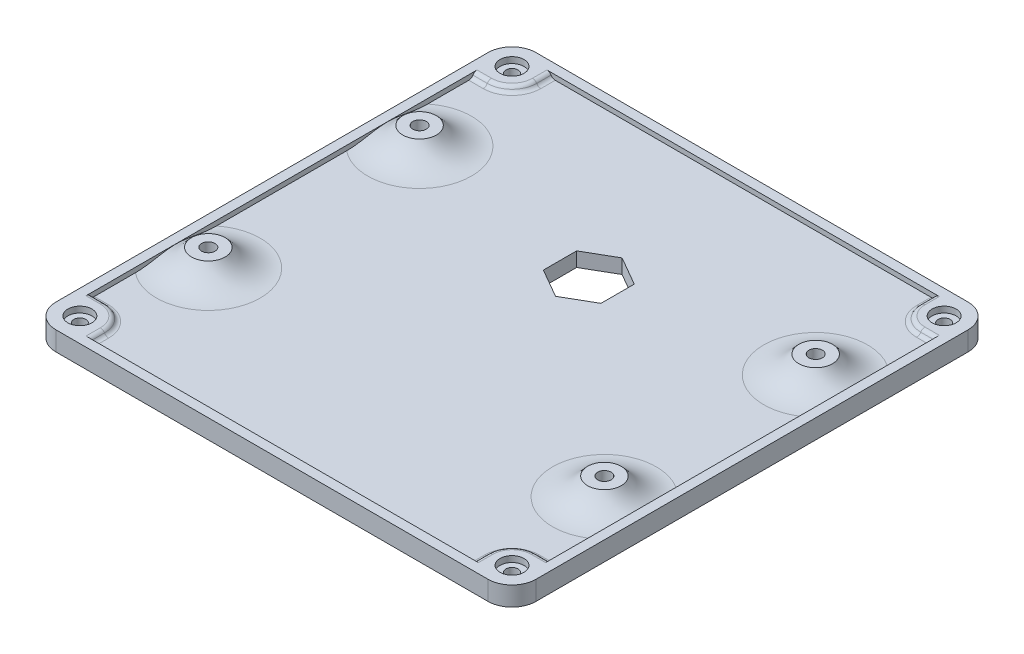
from build123d import *

# Parameters (mm, degrees)
SKETCH1_W            = 100
SKETCH1_H            = 100
BOSS_EXTRUDE1_DEPTH  = 4
SKETCH2_W            = 96
SKETCH2_H            = 96
CUT_EXTRUDE1_DEPTH   = 1
SKETCH7_W            = 8
SKETCH7_H            = 8
BOSS_EXTRUDE4_DEPTH  = 1
SKETCH9_W            = 8
SKETCH9_H            = 8
BOSS_EXTRUDE5_DEPTH  = 1
SKETCH10_W           = 8
SKETCH10_H           = 8
BOSS_EXTRUDE6_DEPTH  = 1
SKETCH11_W           = 8
SKETCH11_H           = 8
BOSS_EXTRUDE7_DEPTH  = 1
FILLET8_R            = 5
FILLET9_R            = 5
FILLET10_R           = 5
FILLET11_R           = 5
FILLET12_R           = 5
FILLET13_R           = 5
FILLET14_R           = 5
FILLET15_R           = 5
FILLET18_R           = 1
FILLET19_R           = 1
FILLET20_R           = 1
FILLET21_R           = 1
FILLET22_R           = 1
FILLET23_R           = 1
FILLET24_R           = 1
FILLET25_R           = 1
SKETCH15_R           = 2.5
CUT_EXTRUDE7_DEPTH   = 1.25
CUT_EXTRUDE8_START   = -1.25
SKETCH16_R           = 2.5
CUT_EXTRUDE8_DEPTH   = 1.25
SKETCH17_R           = 1.1
CUT_EXTRUDE9_DEPTH   = 1.5
SKETCH18_R           = 2.5
CUT_EXTRUDE10_DEPTH  = 1.25
CUT_EXTRUDE11_START  = -1.25
SKETCH19_R           = 2.5
CUT_EXTRUDE11_DEPTH  = 1.25
SKETCH20_R           = 1.05
CUT_EXTRUDE12_DEPTH  = 71.764132864
SKETCH21_R           = 2.5
CUT_EXTRUDE13_DEPTH  = 1.25
CUT_EXTRUDE14_START  = -1.25
SKETCH23_R           = 2.5
CUT_EXTRUDE14_DEPTH  = 1.25
SKETCH24_R           = 1.05
CUT_EXTRUDE15_DEPTH  = 71.764132864
SKETCH25_R           = 2.5
CUT_EXTRUDE16_DEPTH  = 1.25
CUT_EXTRUDE17_START  = -1.25
SKETCH26_R           = 2.5
CUT_EXTRUDE17_DEPTH  = 1.25
SKETCH27_R           = 1.05
CUT_EXTRUDE18_DEPTH  = 71.764132864
SKETCH35_R           = 1.25
CUT_EXTRUDE23_DEPTH  = 71.764132864
SKETCH36_R           = 1.25
CUT_EXTRUDE24_DEPTH  = 71.764132864
SKETCH37_R           = 1.25
CUT_EXTRUDE25_DEPTH  = 71.764132864
SKETCH38_R           = 1.25
CUT_EXTRUDE26_DEPTH  = 71.764132864
SKETCH39_R           = 3.5
SKETCH39_R_2         = 1.4
BOSS_EXTRUDE12_DEPTH = 3.75
FILLET27_R           = 9
CUT_EXTRUDE27_DEPTH  = 71.810045197


# Some blends are built 0.0001 mm under size
with BuildPart() as part:
    # Sketch1 → Boss-Extrude1 (new body)
    with BuildSketch(Plane(origin=(0, 0, 0), x_dir=(1, 0, 0), z_dir=(0, 1, 0))):
        Rectangle(SKETCH1_W, SKETCH1_H)
    extrude(amount=BOSS_EXTRUDE1_DEPTH)

    # Sketch2 → Cut-Extrude1 (cut)
    with BuildSketch(Plane(origin=(0, 4, 0), x_dir=(1, 0, 0), z_dir=(0, 1, 0))):
        Rectangle(SKETCH2_W, SKETCH2_H)
    extrude(amount=-CUT_EXTRUDE1_DEPTH, mode=Mode.SUBTRACT)

    # Sketch7 → Boss-Extrude4 (add)
    with BuildSketch(Plane(origin=(0, 3, 0), x_dir=(1, 0, 0), z_dir=(0, 1, 0))):
        with Locations((-44, 44)):
            Rectangle(SKETCH7_W, SKETCH7_H)
    extrude(amount=BOSS_EXTRUDE4_DEPTH)

    # Sketch9 → Boss-Extrude5 (add)
    with BuildSketch(Plane(origin=(0, 3, 0), x_dir=(1, 0, 0), z_dir=(0, 1, 0))):
        with Locations((44, 44)):
            Rectangle(SKETCH9_W, SKETCH9_H)
    extrude(amount=BOSS_EXTRUDE5_DEPTH)

    # Sketch10 → Boss-Extrude6 (add)
    with BuildSketch(Plane(origin=(0, 3, 0), x_dir=(1, 0, 0), z_dir=(0, 1, 0))):
        with Locations((-44, -44)):
            Rectangle(SKETCH10_W, SKETCH10_H)
    extrude(amount=BOSS_EXTRUDE6_DEPTH)

    # Sketch11 → Boss-Extrude7 (add)
    with BuildSketch(Plane(origin=(0, 3, 0), x_dir=(1, 0, 0), z_dir=(0, 1, 0))):
        with Locations((44, -44)):
            Rectangle(SKETCH11_W, SKETCH11_H)
    extrude(amount=BOSS_EXTRUDE7_DEPTH)

    # Fillet8
    fillet8_edges = [part.edges().sort_by_distance(p)[0] for p in [
        (-40, 3.5, -40),
    ]]
    fillet(fillet8_edges, radius=FILLET8_R)

    # Fillet9
    fillet9_edges = [part.edges().sort_by_distance(p)[0] for p in [
        (-40, 3.5, 40),
    ]]
    fillet(fillet9_edges, radius=FILLET9_R)

    # Fillet10
    fillet10_edges = [part.edges().sort_by_distance(p)[0] for p in [
        (40, 3.5, 40),
    ]]
    fillet(fillet10_edges, radius=FILLET10_R)

    # Fillet11
    fillet11_edges = [part.edges().sort_by_distance(p)[0] for p in [
        (40, 3.5, -40),
    ]]
    fillet(fillet11_edges, radius=FILLET11_R)

    # Fillet12
    fillet12_edges = [part.edges().sort_by_distance(p)[0] for p in [
        (50, 2, -50),
    ]]
    fillet(fillet12_edges, radius=FILLET12_R)

    # Fillet13
    fillet13_edges = [part.edges().sort_by_distance(p)[0] for p in [
        (50, 2, 50),
    ]]
    fillet(fillet13_edges, radius=FILLET13_R)

    # Fillet14
    fillet14_edges = [part.edges().sort_by_distance(p)[0] for p in [
        (-50, 2, 50),
    ]]
    fillet(fillet14_edges, radius=FILLET14_R)

    # Fillet15
    fillet15_edges = [part.edges().sort_by_distance(p)[0] for p in [
        (-50, 2, -50),
    ]]
    fillet(fillet15_edges, radius=FILLET15_R)

    # Fillet18
    fillet18_edges = [part.edges().sort_by_distance(p)[0] for p in [
        (-40, 3, -46.5),
        (-46.5, 3, -40),
        (-41.464466094, 3, -41.464466094),
    ]]
    fillet(fillet18_edges, radius=FILLET18_R - 0.0001)  # a hair under: the kernel refuses the full size

    # Fillet19
    # the kernel refuses this fillet: 1 mm, written as the material it takes off along each edge
    with BuildSketch(Plane(origin=(-45, 4, -40), x_dir=(0, 0, -1), z_dir=(-1, 0, 0))) as fillet19_piece_1:
        with BuildLine():
            CenterArc((0.732093072, 1), FILLET19_R, 209.998345944, 60.001654056)
            Line((-0.133946766, 0.500025001), (-0.22055075, 0.450027501))
            ThreePointArc((-0.22055075, 0.450027501), (-0.1, 0.0001), (-0.1, 0))
            Line((-0.1, 0), (0, -0.1))
            Line((0, -0.1), (0.732093072, -0.1))
            Line((0.732093072, -0.1), (0.732093072, 0))
        make_face()
    extrude(amount=3, mode=Mode.SUBTRACT)
    with BuildSketch(Plane(origin=(-40, 4, -48), x_dir=(0.2587568099374835, -0.9659425000024469, 0), z_dir=(0, 0, 1))) as fillet19_piece_2:
        with BuildLine():
            CenterArc((0.776508432, -0.965916622), FILLET19_R, 105.002037513, 60.001654056)
            Line((-0.189434068, -0.707159812), (-0.286028318, -0.681284131))
            Line((-0.286028318, -0.681284131), (-0.09659425, 0.025875681))
            Line((-0.09659425, 0.025875681), (0.025875681, 0.09659425))
            ThreePointArc((0.025875681, 0.09659425), (0.025972275, 0.096568374), (0.491769698, 0.096591662))
            Line((0.491769698, 0.096591662), (0.517655038, 0))
        make_face()
    extrude(amount=3, mode=Mode.SUBTRACT)
    with BuildSketch(Plane(origin=(-45, 4, -45), x_dir=(0, 0, 1), z_dir=(-1, 0, 0))) as fillet19_piece_3:
        with BuildLine():
            CenterArc((4.267906928, -1), FILLET19_R, 29.998345944, 60.001654056)
            Line((5.133946766, -0.500025001), (5.22055075, -0.450027501))
            ThreePointArc((5.22055075, -0.450027501), (5.1, -0.0001), (5.1, 0))
            Line((5.1, 0), (5, 0.1))
            Line((5, 0.1), (4.267906928, 0.1))
            Line((4.267906928, 0.1), (4.267906928, 0))
        make_face()
    revolve(axis=Axis((-45, 4, -45), (0, 1, 0)), revolution_arc=90, mode=Mode.SUBTRACT)

    # Fillet20
    fillet20_edges = [part.edges().sort_by_distance(p)[0] for p in [
        (40, 4, -46.5),
        (46.5, 4, -40),
        (41.464466094, 4, -41.464466094),
    ]]
    fillet(fillet20_edges, radius=FILLET20_R - 0.0001)  # a hair under: the kernel refuses the full size

    # Fillet21
    fillet21_edges = [part.edges().sort_by_distance(p)[0] for p in [
        (46.5, 3, -40),
        (41.464466094, 3, -41.464466094),
        (40, 3, -46.5),
    ]]
    fillet(fillet21_edges, radius=FILLET21_R)

    # Fillet22
    fillet22_edges = [part.edges().sort_by_distance(p)[0] for p in [
        (-46.5, 3, 40),
        (-40, 3, 46.5),
        (-41.464466094, 3, 41.464466094),
    ]]
    fillet(fillet22_edges, radius=FILLET22_R - 0.0001)  # a hair under: the kernel refuses the full size

    # Fillet23
    # the kernel refuses this fillet: 1 mm, written as the material it takes off along each edge
    with BuildSketch(Plane(origin=(-40, 4, 48), x_dir=(-1, 0, 0), z_dir=(0, 0, -1))) as fillet23_piece_1:
        with BuildLine():
            CenterArc((0.732093072, -1), FILLET23_R, 90, 60.001654056)
            Line((-0.133946766, -0.500025001), (-0.22055075, -0.450027501))
            ThreePointArc((-0.22055075, -0.450027501), (-0.1, -0.0001), (-0.1, 0))
            Line((-0.1, 0), (0, 0.1))
            Line((0, 0.1), (0.732093072, 0.1))
            Line((0.732093072, 0.1), (0.732093072, 0))
        make_face()
    extrude(amount=3, mode=Mode.SUBTRACT)
    with BuildSketch(Plane(origin=(-45, 4, 40), x_dir=(0, -0.9659425000024469, -0.2587568099374835), z_dir=(-1, 0, 0))) as fillet23_piece_2:
        with BuildLine():
            CenterArc((0.776508432, 0.965916622), FILLET23_R, 194.996308431, 60.001654056)
            Line((-0.189434068, 0.707159812), (-0.286028318, 0.681284131))
            Line((-0.286028318, 0.681284131), (-0.09659425, -0.025875681))
            Line((-0.09659425, -0.025875681), (0.025875681, -0.09659425))
            ThreePointArc((0.025875681, -0.09659425), (0.025972275, -0.096568374), (0.491769698, -0.096591662))
            Line((0.491769698, -0.096591662), (0.517655038, 0))
        make_face()
    extrude(amount=3, mode=Mode.SUBTRACT)
    with BuildSketch(Plane(origin=(-45, 4, 45), x_dir=(0, 0, -1), z_dir=(-1, 0, 0))) as fillet23_piece_3:
        with BuildLine():
            CenterArc((4.267906928, 1), FILLET23_R, 270, 60.001654056)
            Line((5.133946766, 0.500025001), (5.22055075, 0.450027501))
            ThreePointArc((5.22055075, 0.450027501), (5.1, 0.0001), (5.1, 0))
            Line((5.1, 0), (5, -0.1))
            Line((5, -0.1), (4.267906928, -0.1))
            Line((4.267906928, -0.1), (4.267906928, 0))
        make_face()
    revolve(axis=Axis((-45, 4, 45), (0, -1, 0)), revolution_arc=90, mode=Mode.SUBTRACT)

    # Fillet24
    fillet24_edges = [part.edges().sort_by_distance(p)[0] for p in [
        (46.5, 4, 40),
        (40, 4, 46.5),
        (41.464466094, 4, 41.464466094),
    ]]
    fillet(fillet24_edges, radius=FILLET24_R - 0.0001)  # a hair under: the kernel refuses the full size

    # Fillet25
    fillet25_edges = [part.edges().sort_by_distance(p)[0] for p in [
        (40, 3, 46.5),
        (41.464466094, 3, 41.464466094),
        (46.5, 3, 40),
    ]]
    fillet(fillet25_edges, radius=FILLET25_R)

    # Sketch15 → Cut-Extrude7 (cut)
    with BuildSketch(Plane(origin=(0, 4, 0), x_dir=(1, 0, 0), z_dir=(0, 1, 0))):
        with Locations(Location((-45, 45, 0), (0, 0, 270))):
            Circle(SKETCH15_R)
    extrude(amount=-CUT_EXTRUDE7_DEPTH, mode=Mode.SUBTRACT)

    # Sketch16 → Cut-Extrude8 (cut)
    with BuildSketch(Plane.XZ.offset(CUT_EXTRUDE8_START)):
        with Locations(Location((-45, -45, 0), (0, 0, 90))):
            Circle(SKETCH16_R)
    extrude(amount=CUT_EXTRUDE8_DEPTH, mode=Mode.SUBTRACT)

    # Sketch17 → Cut-Extrude9 (cut)
    with BuildSketch(Plane(origin=(0, 2.75, 0), x_dir=(1, 0, 0), z_dir=(0, 1, 0))):
        with Locations(Location((-45, 45, 0), (0, 0, 270))):
            Circle(SKETCH17_R)
    extrude(amount=-CUT_EXTRUDE9_DEPTH, mode=Mode.SUBTRACT)

    # Sketch18 → Cut-Extrude10 (cut)
    with BuildSketch(Plane(origin=(0, 4, 0), x_dir=(1, 0, 0), z_dir=(0, 1, 0))):
        with Locations(Location((45, 45, 0), (0, 0, 270))):
            Circle(SKETCH18_R)
    extrude(amount=-CUT_EXTRUDE10_DEPTH, mode=Mode.SUBTRACT)

    # Sketch19 → Cut-Extrude11 (cut)
    with BuildSketch(Plane.XZ.offset(CUT_EXTRUDE11_START)):
        with Locations(Location((45, -45, 0), (0, 0, 90))):
            Circle(SKETCH19_R)
    extrude(amount=CUT_EXTRUDE11_DEPTH, mode=Mode.SUBTRACT)

    # Sketch20 → Cut-Extrude12 (cut, through all)
    with BuildSketch(Plane(origin=(0, 2.75, 0), x_dir=(1, 0, 0), z_dir=(0, 1, 0))):
        with Locations(Location((45, 45, 0), (0, 0, 270))):
            Circle(SKETCH20_R)
    extrude(amount=-CUT_EXTRUDE12_DEPTH, mode=Mode.SUBTRACT)

    # Sketch21 → Cut-Extrude13 (cut)
    with BuildSketch(Plane(origin=(0, 4, 0), x_dir=(1, 0, 0), z_dir=(0, 1, 0))):
        with Locations(Location((-45, -45, 0), (0, 0, 270))):
            Circle(SKETCH21_R)
    extrude(amount=-CUT_EXTRUDE13_DEPTH, mode=Mode.SUBTRACT)

    # Sketch23 → Cut-Extrude14 (cut)
    with BuildSketch(Plane(origin=(0, 0, 0), x_dir=(-1, 0, 0), z_dir=(0, -1, 0)).offset(CUT_EXTRUDE14_START)):
        with Locations(Location((45, -45, 0), (0, 0, 270))):
            Circle(SKETCH23_R)
    extrude(amount=CUT_EXTRUDE14_DEPTH, mode=Mode.SUBTRACT)

    # Sketch24 → Cut-Extrude15 (cut, through all)
    with BuildSketch(Plane(origin=(0, 2.75, 0), x_dir=(1, 0, 0), z_dir=(0, 1, 0))):
        with Locations(Location((-45, -45, 0), (0, 0, 270))):
            Circle(SKETCH24_R)
    extrude(amount=-CUT_EXTRUDE15_DEPTH, mode=Mode.SUBTRACT)

    # Sketch25 → Cut-Extrude16 (cut)
    with BuildSketch(Plane.XZ):
        with Locations(Location((45, 45, 0), (0, 0, 270))):
            Circle(SKETCH25_R)
    extrude(amount=-CUT_EXTRUDE16_DEPTH, mode=Mode.SUBTRACT)

    # Sketch26 → Cut-Extrude17 (cut)
    with BuildSketch(Plane(origin=(0, 4, 0), x_dir=(1, 0, 0), z_dir=(0, 1, 0)).offset(CUT_EXTRUDE17_START)):
        with Locations(Location((45, -45, 0), (0, 0, 90))):
            Circle(SKETCH26_R)
    extrude(amount=CUT_EXTRUDE17_DEPTH, mode=Mode.SUBTRACT)

    # Sketch27 → Cut-Extrude18 (cut, through all)
    with BuildSketch(Plane(origin=(0, 2.75, 0), x_dir=(1, 0, 0), z_dir=(0, 1, 0))):
        with Locations(Location((45, -45, 0), (0, 0, 270))):
            Circle(SKETCH27_R)
    extrude(amount=-CUT_EXTRUDE18_DEPTH, mode=Mode.SUBTRACT)

    # Sketch35 → Cut-Extrude23 (cut, through all)
    with BuildSketch(Plane(origin=(0, 2.75, 0), x_dir=(1, 0, 0), z_dir=(0, 1, 0))):
        with Locations(Location((-45, 45, 0), (0, 0, 270))):
            Circle(SKETCH35_R)
    extrude(amount=-CUT_EXTRUDE23_DEPTH, mode=Mode.SUBTRACT)

    # Sketch36 → Cut-Extrude24 (cut, through all)
    with BuildSketch(Plane(origin=(0, 2.75, 0), x_dir=(1, 0, 0), z_dir=(0, 1, 0))):
        with Locations(Location((45, 45, 0), (0, 0, 270))):
            Circle(SKETCH36_R)
    extrude(amount=-CUT_EXTRUDE24_DEPTH, mode=Mode.SUBTRACT)

    # Sketch37 → Cut-Extrude25 (cut, through all)
    with BuildSketch(Plane(origin=(0, 2.75, 0), x_dir=(1, 0, 0), z_dir=(0, 1, 0))):
        with Locations(Location((-45, -45, 0), (0, 0, 270))):
            Circle(SKETCH37_R)
    extrude(amount=-CUT_EXTRUDE25_DEPTH, mode=Mode.SUBTRACT)

    # Sketch38 → Cut-Extrude26 (cut, through all)
    with BuildSketch(Plane(origin=(0, 2.75, 0), x_dir=(1, 0, 0), z_dir=(0, 1, 0))):
        with Locations(Location((45, -45, 0), (0, 0, 270))):
            Circle(SKETCH38_R)
    extrude(amount=-CUT_EXTRUDE26_DEPTH, mode=Mode.SUBTRACT)

    # Sketch39 → Boss-Extrude12 (add)
    # profile 1 of 4: a face of its own
    with BuildSketch(Plane(origin=(0, 3, 0), x_dir=(1, 0, 0), z_dir=(0, 1, 0))):
        with Locations(Location((41.25, 22, 0), (0, 0, 90))):
            Circle(SKETCH39_R)
        with Locations(Location((41.25, 22, 0), (0, 0, 270))):
            Circle(SKETCH39_R_2, mode=Mode.SUBTRACT)
    # profile 2 of 4: a face of its own
    with BuildSketch(Plane(origin=(0, 3, 0), x_dir=(1, 0, 0), z_dir=(0, 1, 0))):
        with Locations(Location((-41.25, 22, 0), (0, 0, 90))):
            Circle(SKETCH39_R)
        with Locations(Location((-41.25, 22, 0), (0, 0, 270))):
            Circle(SKETCH39_R_2, mode=Mode.SUBTRACT)
    # profile 3 of 4: a face of its own
    with BuildSketch(Plane(origin=(0, 3, 0), x_dir=(1, 0, 0), z_dir=(0, 1, 0))):
        with Locations(Location((-41.25, -22, 0), (0, 0, 90))):
            Circle(SKETCH39_R)
        with Locations(Location((-41.25, -22, 0), (0, 0, 270))):
            Circle(SKETCH39_R_2, mode=Mode.SUBTRACT)
    # profile 4 of 4: a face of its own
    with BuildSketch(Plane(origin=(0, 3, 0), x_dir=(1, 0, 0), z_dir=(0, 1, 0))):
        with Locations(Location((41.25, -22, 0), (0, 0, 90))):
            Circle(SKETCH39_R)
        with Locations(Location((41.25, -22, 0), (0, 0, 270))):
            Circle(SKETCH39_R_2, mode=Mode.SUBTRACT)
    extrude(amount=BOSS_EXTRUDE12_DEPTH)

    # Fillet27
    # the kernel refuses this fillet: 9 mm, written as the material it adds along each edge
    with BuildSketch(Plane(origin=(41.25, 3, -22), x_dir=(0, 0, -1), z_dir=(1, 0, 0))) as fillet27_piece_1_section:
        with BuildLine():
            CenterArc((10.810095759, 9), FILLET27_R, 215.685334713, 54.314665287)
            Line((3.5, 3.75), (3.5, 0))
            Line((3.5, 0), (10.810095759, 0))
        make_face()
    fillet27_piece_1 = revolve(axis=Axis((41.25, 3, -22), (0, 1, 0)), mode=Mode.PRIVATE)
    fillet27_piece_1 = split(fillet27_piece_1, bisect_by=Plane(origin=(48, 3, -22), z_dir=(-1, 0, 0)), keep=Keep.TOP, mode=Mode.PRIVATE)
    add(fillet27_piece_1)
    with BuildSketch(Plane(origin=(-41.25, 3, -22), x_dir=(0, 0, -1), z_dir=(1, 0, 0))) as fillet27_piece_2_section:
        with BuildLine():
            CenterArc((10.810095759, 9), FILLET27_R, 215.685334713, 54.314665287)
            Line((3.5, 3.75), (3.5, 0))
            Line((3.5, 0), (10.810095759, 0))
        make_face()
    fillet27_piece_2 = revolve(axis=Axis((-41.25, 3, -22), (0, 1, 0)), mode=Mode.PRIVATE)
    fillet27_piece_2 = split(fillet27_piece_2, bisect_by=Plane(origin=(-48, 3, -22), z_dir=(1, 0, 0)), keep=Keep.TOP, mode=Mode.PRIVATE)
    add(fillet27_piece_2)
    with BuildSketch(Plane(origin=(-41.25, 3, 22), x_dir=(0, 0, -1), z_dir=(1, 0, 0))) as fillet27_piece_3_section:
        with BuildLine():
            CenterArc((10.810095759, 9), FILLET27_R, 215.685334713, 54.314665287)
            Line((3.5, 3.75), (3.5, 0))
            Line((3.5, 0), (10.810095759, 0))
        make_face()
    fillet27_piece_3 = revolve(axis=Axis((-41.25, 3, 22), (0, 1, 0)), mode=Mode.PRIVATE)
    fillet27_piece_3 = split(fillet27_piece_3, bisect_by=Plane(origin=(-48, 3, 22), z_dir=(1, 0, 0)), keep=Keep.TOP, mode=Mode.PRIVATE)
    add(fillet27_piece_3)
    with BuildSketch(Plane(origin=(41.25, 3, 22), x_dir=(0, 0, -1), z_dir=(1, 0, 0))) as fillet27_piece_4_section:
        with BuildLine():
            CenterArc((10.810095759, 9), FILLET27_R, 215.685334713, 54.314665287)
            Line((3.5, 3.75), (3.5, 0))
            Line((3.5, 0), (10.810095759, 0))
        make_face()
    fillet27_piece_4 = revolve(axis=Axis((41.25, 3, 22), (0, 1, 0)), mode=Mode.PRIVATE)
    fillet27_piece_4 = split(fillet27_piece_4, bisect_by=Plane(origin=(48, 3, 22), z_dir=(-1, 0, 0)), keep=Keep.TOP, mode=Mode.PRIVATE)
    add(fillet27_piece_4)

    # Sketch40 → Cut-Extrude27 (cut, through all)
    with BuildSketch(Plane(origin=(0, 3, 0), x_dir=(1, 0, 0), z_dir=(0, 1, 0))):
        Polygon((0, 9.07179677), (6, 12.535898385), (6, 19.464101615), (0, 22.92820323), (-6, 19.464101615), (-6, 12.535898385), align=None)
    extrude(amount=-CUT_EXTRUDE27_DEPTH, mode=Mode.SUBTRACT)


solid = part.part
